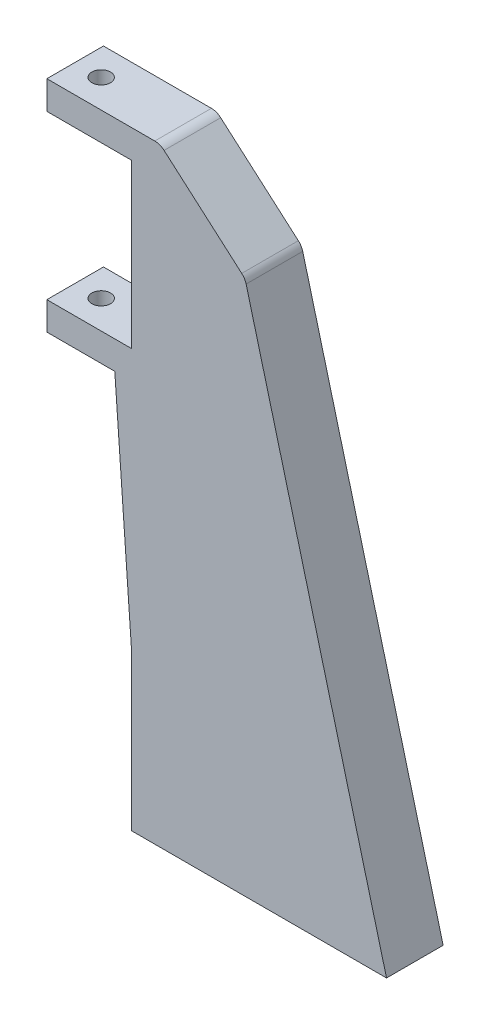
from build123d import *

# Parameters (mm, degrees)
BOSS_EXTRUDE1_DEPTH = 25.4
SKETCH2_W           = 38.1
SKETCH2_H           = 38.1
CUT_EXTRUDE1_DEPTH  = 12.7
SKETCH3_R           = 4.191
CUT_EXTRUDE2_DEPTH  = 314.875552812
SKETCH4_R           = 4.191
CUT_EXTRUDE3_DEPTH  = 25.4
FILLET1_R           = 6.35
FILLET2_R           = 3.175


with BuildPart() as part:
    # Sketch1 → Boss-Extrude1 (new body)
    with BuildSketch(Plane.XY):
        Polygon((0, 0), (0, 12.7), (50.8, 12.7), (88.9, -20.510228633), (152.4, -260.515926793), (38.018659419, -260.515926793), (38.018659419, -190.696503564), (30.48, -85.763926793), (0, -85.763926793), (0, -73.152260366), (38.018659419, -73.152260366), (38.018659419, 0), align=None)
    extrude(amount=BOSS_EXTRUDE1_DEPTH)

    # Sketch2 → Cut-Extrude1 (cut)
    with BuildSketch(Plane(origin=(0, 0, 0), x_dir=(-1, 0, 0), z_dir=(0, 0, -1))):
        with Locations((-82.468659419, -163.487926793)):
            Rectangle(SKETCH2_W, SKETCH2_H)
    extrude(amount=-CUT_EXTRUDE1_DEPTH, mode=Mode.SUBTRACT)

    # Sketch3 → Cut-Extrude2 (cut, through all)
    with BuildSketch(Plane(origin=(0, 12.7, 0), x_dir=(1, 0, 0), z_dir=(0, 1, 0))):
        with Locations(Location((11.684, -12.7, 0), (0, 0, 270))):
            Circle(SKETCH3_R)
    extrude(amount=-CUT_EXTRUDE2_DEPTH, mode=Mode.SUBTRACT)

    # Sketch4 → Cut-Extrude3 (cut)
    with BuildSketch(Plane(origin=(0, -260.515926793, 0), x_dir=(-1, 0, 0), z_dir=(0, -1, 0))):
        with Locations(Location((-139.7, -12.7, 0), (0, 0, 180))):
            Circle(SKETCH4_R)
        with Locations(Location((-63.5, -11.81655653, 0), (0, 0, 180))):
            Circle(SKETCH4_R)
    extrude(amount=-CUT_EXTRUDE3_DEPTH, mode=Mode.SUBTRACT)

    # Fillet1
    # the kernel refuses this fillet: 6.35 mm, written as the material it adds along each edge
    with BuildSketch(Plane(origin=(38.018659419, -190.696503564, 0), x_dir=(0, -1, 0), z_dir=(0, 0, 1))) as fillet1_piece_1:
        with BuildLine():
            CenterArc((FILLET1_R * 0.0358752122725, -FILLET1_R), FILLET1_R, 90, 4.109234206)
            Line((-FILLET1_R * 0.0357829859603, -FILLET1_R * 0.00257075307266), (0, 0))
            Line((0, 0), (FILLET1_R * 0.0358752122725, 0))
        make_face()
    extrude(amount=25.4)
    # the kernel refuses this fillet: 6.35 mm, written as the material it takes off along each edge
    with BuildSketch(Plane(origin=(50.8, 12.7, -5.947635314), x_dir=(-1, 0, 0), z_dir=(0, 0, 1))) as fillet1_2_piece_1:
        with BuildLine():
            CenterArc((FILLET1_R * 0.374654193004, FILLET1_R), FILLET1_R, 228.922654606, 41.077345394)
            Line((-FILLET1_R * 0.282423044355, FILLET1_R * 0.246176742103), (0, 0))
            Line((0, 0), (FILLET1_R * 0.374654193004, 0))
        make_face()
    extrude(amount=37.295270628, mode=Mode.SUBTRACT)
    with BuildSketch(Plane(origin=(88.9, -20.510228633, -4.869092834), x_dir=(-0.7538232578965339, 0.6570772373581782, 0), z_dir=(0, 0, 1))) as fillet1_2_piece_2:
        with BuildLine():
            CenterArc((FILLET1_R * 0.306714509228, FILLET1_R), FILLET1_R, 235.896927034, 34.103072966)
            Line((-FILLET1_R * 0.253968896194, FILLET1_R * 0.171969735526), (0, 0))
            Line((0, 0), (FILLET1_R * 0.306714509228, 0))
        make_face()
    extrude(amount=35.138185668, mode=Mode.SUBTRACT)

    # Fillet2
    fillet2_edges = [part.edges().sort_by_distance(p)[0] for p in [
        (101.518659419, -182.537926793, 6.35),
        (101.518659419, -144.437926793, 6.35),
        (63.418659419, -144.437926793, 6.35),
        (63.418659419, -182.537926793, 6.35),
    ]]
    fillet(fillet2_edges, radius=FILLET2_R)


solid = part.part
